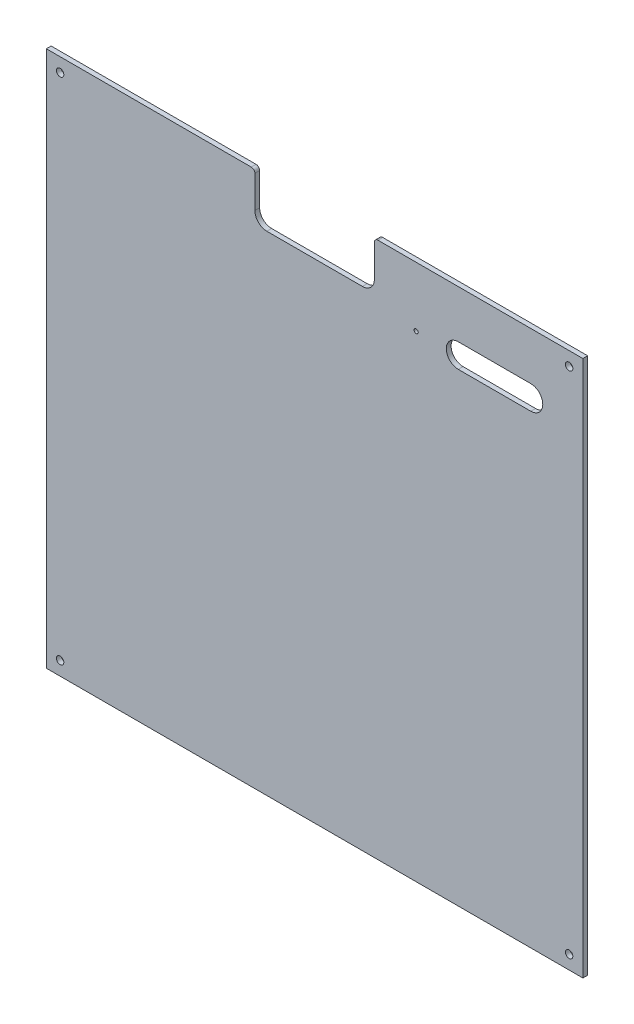
from build123d import *

# Parameters (mm, degrees)
SCHIZZO1_R                   = 3.1
SCHIZZO1_R_2                 = 1.75
ESTRUSIONE_ESTRUSIONE1_DEPTH = 4


with BuildPart() as part:
    # Schizzo1 → Estrusione-Estrusione1 (new body)
    with BuildSketch(Plane.XY):
        with BuildLine():
            Line((0, 0), (0, 449))
            Line((0, 449), (171.5, 449))
            ThreePointArc((171.5, 449), (173.621320344, 448.121320344), (174.5, 446))
            Line((174.5, 446), (174.5, 419))
            ThreePointArc((174.5, 419), (177.428932188, 411.928932188), (184.5, 409))
            Line((184.5, 409), (264.5, 409))
            ThreePointArc((264.5, 409), (271.571067812, 411.928932188), (274.5, 419))
            Line((274.5, 419), (274.5, 446))
            ThreePointArc((274.5, 446), (275.378679656, 448.121320344), (277.5, 449))
            Line((277.5, 449), (449, 449))
            Line((449, 449), (449, 0))
            Line((449, 0), (0, 0))
        make_face()
        with Locations((11.5, 11.5)):
            Circle(SCHIZZO1_R, mode=Mode.SUBTRACT)
        with Locations((437.5, 11.5)):
            Circle(SCHIZZO1_R, mode=Mode.SUBTRACT)
        with Locations((437.5, 437.5)):
            Circle(SCHIZZO1_R, mode=Mode.SUBTRACT)
        with Locations((11.5, 437.5)):
            Circle(SCHIZZO1_R, mode=Mode.SUBTRACT)
        with Locations((309.5, 399)):
            Circle(SCHIZZO1_R_2, mode=Mode.SUBTRACT)
        with BuildLine():
            Line((344.715899345, 409), (405.440355678, 409))
            ThreePointArc((405.440355678, 409), (415.440355678, 399), (405.440355678, 389))
            Line((405.440355678, 389), (344.715899345, 389))
            ThreePointArc((344.715899345, 389), (334.715899345, 399), (344.715899345, 409))
        make_face(mode=Mode.SUBTRACT)
    extrude(amount=ESTRUSIONE_ESTRUSIONE1_DEPTH)


solid = part.part
